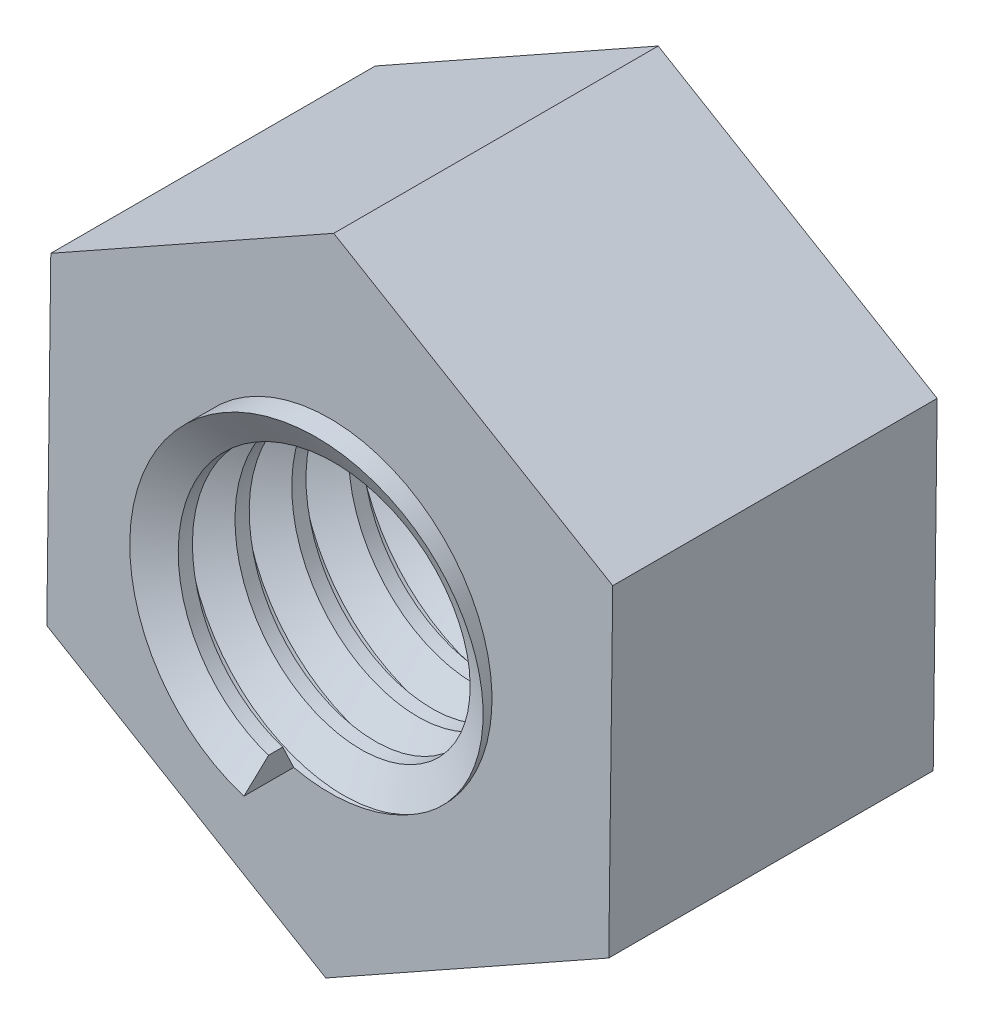
from build123d import *

# Parameters (mm, degrees)
BOSS_EXTRUDE1_DEPTH = 10
SKETCH2_R           = 5
CUT_EXTRUDE1_DEPTH  = 17.615240331
THREAD1_PITCH       = 1.75


with BuildPart() as part:
    # Sketch1 → Boss-Extrude1 (new body)
    with BuildSketch(Plane.XY):
        Polygon((8.598913538, -5.106244862), (8.721594537, 4.893755138), (0.122680999, 10), (-8.598913538, 5.106244862), (-8.721594537, -4.893755138), (-0.122680999, -10), align=None)
    extrude(amount=BOSS_EXTRUDE1_DEPTH)

    # Sketch2 → Cut-Extrude1 (cut, through all)
    with BuildSketch(Plane(origin=(0, 0, 0), x_dir=(-1, 0, 0), z_dir=(0, 0, -1))):
        Circle(SKETCH2_R)
    extrude(amount=-CUT_EXTRUDE1_DEPTH, mode=Mode.SUBTRACT)

    # Thread1: the profile of Thread Profile3 profile screwed along a right-hand helix of 5.714286 turns, 10 arcs to a turn; built about Z, then put on its axis
    thread1_z = Axis((0, 0, 0), (0, 0, 1))
    thread1_corners = [(5.0003, 0, -0.000173205), (5.0003, 0, 1.5314232), (4.052784719, 0, 0.984374998), (4.052784719, 0, 0.546874998)]
    with BuildLine(mode=Mode.PRIVATE) as thread1_profile:
        Line(thread1_corners[0], thread1_corners[1])
        Line(thread1_corners[1], thread1_corners[2])
        Line(thread1_corners[2], thread1_corners[3])
        Line(thread1_corners[3], thread1_corners[0])
    thread1_cap = Face(thread1_profile.wire())
    thread1_turn_angles = [0, 18, 36, 54, 72, 90, 108, 126, 144, 162, 180, 198, 216, 234, 252, 270, 288, 306, 324, 342, 360]
    thread1_turn_weights = [1, 0.9510565162951535, 1, 0.9510565162951535, 1, 0.9510565162951535, 1, 0.9510565162951535, 1, 0.9510565162951535, 1, 0.9510565162951535, 1, 0.9510565162951535, 1, 0.9510565162951535, 1, 0.9510565162951535, 1, 0.9510565162951535, 1]
    thread1_turn_rails = [Edge.make_bspline([Vector(p[0], p[1], 0).rotate(thread1_z, thread1_turn_angles[k]) / thread1_turn_weights[k] + Vector(0, 0, p[2] + THREAD1_PITCH * thread1_turn_angles[k] / 360) for k in range(21)], [0, 0, 0, 1, 1, 2, 2, 3, 3, 4, 4, 5, 5, 6, 6, 7, 7, 8, 8, 9, 9, 10, 10, 10], 2, thread1_turn_weights) for p in thread1_corners]
    thread1_turn_sides = [Face.make_surface_from_curves(thread1_turn_rails[p[0]], thread1_turn_rails[p[1]]) for p in [(0, 1), (1, 2), (2, 3), (3, 0)]]
    thread1_last_angles = [1800, 1818, 1836, 1854, 1872, 1890, 1908, 1926, 1944, 1962, 1980, 1998, 2016, 2034, 2052, 2054.571428571, 2057.142857143]
    thread1_last_weights = [1, 0.9510565162951535, 1, 0.9510565162951535, 1, 0.9510565162951535, 1, 0.9510565162951535, 1, 0.9510565162951535, 1, 0.9510565162951535, 1, 0.9510565162951535, 1, 0.9989930665413146, 1]
    thread1_last_rails = [Edge.make_bspline([Vector(p[0], p[1], 0).rotate(thread1_z, thread1_last_angles[k]) / thread1_last_weights[k] + Vector(0, 0, p[2] + THREAD1_PITCH * thread1_last_angles[k] / 360) for k in range(17)], [0, 0, 0, 1, 1, 2, 2, 3, 3, 4, 4, 5, 5, 6, 6, 7, 7, 8, 8, 8], 2, thread1_last_weights) for p in thread1_corners]
    thread1_last_sides = [Face.make_surface_from_curves(thread1_last_rails[p[0]], thread1_last_rails[p[1]]) for p in [(0, 1), (1, 2), (2, 3), (3, 0)]]
    thread1 = Plane(origin=(0, 0, 0), x_dir=(1, 0, 0), z_dir=(0, 0, 1)) * Solid(Shell([*[p.moved(Location((0, 0, THREAD1_PITCH * i))) for i in range(5) for p in thread1_turn_sides], *thread1_last_sides, thread1_cap, thread1_cap.rotate(thread1_z, 2057.142857143).moved(Location((0, 0, THREAD1_PITCH * 2057.142857143 / 360)))]))
    add(thread1)


solid = part.part
